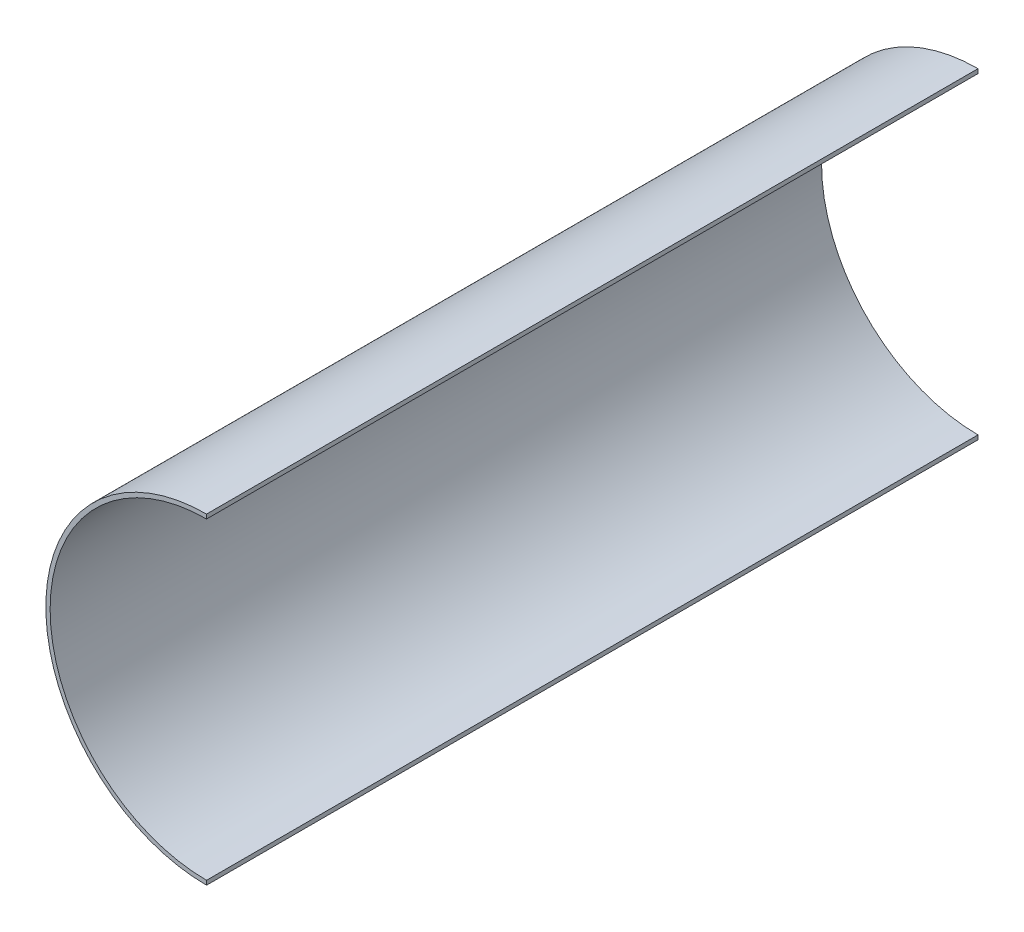
from build123d import *

# Parameters (mm, degrees)
SCHIZZO1_R                = 75
SCHIZZO1_R_2              = 73
ESTRUSIONE_SOTTILE1_DEPTH = 360
TAGLIO_ESTRUSIONE1_DEPTH  = 391


with BuildPart() as part:
    # Schizzo1 → Estrusione-Sottile1 (new body)
    with BuildSketch(Plane.XY):
        Circle(SCHIZZO1_R)
        Circle(SCHIZZO1_R_2, mode=Mode.SUBTRACT)
    extrude(amount=ESTRUSIONE_SOTTILE1_DEPTH)

    # Schizzo5 → Taglio-Estrusione1 (cut)
    with BuildSketch(Plane.XY.offset(360)):
        Polygon((0, -86.964599055), (0, 79.838526823), (83.199622108, 79.838526823), (79.968568823, -89.79177068), align=None)
    extrude(amount=-TAGLIO_ESTRUSIONE1_DEPTH, mode=Mode.SUBTRACT)


solid = part.part
